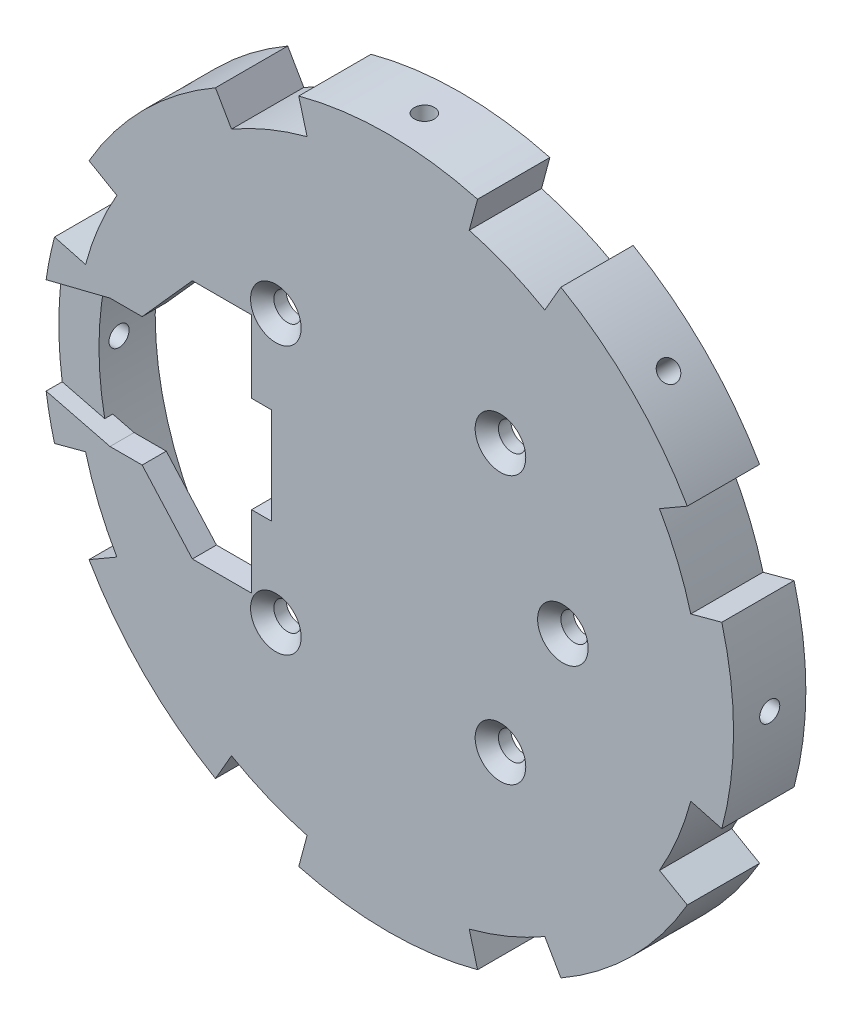
from build123d import *

# Parameters (mm, degrees)
SKETCH_1_R                   = 38
EXTRUDE_1_DEPTH              = 6
EXTRUDE_START                = 3
EXTRUDE_2_DEPTH              = 3
HOLE_WIZARD_M3_1_D           = 3.4
HOLE_WIZARD_M3_1_CSINK_D     = 6.3
HOLE_WIZARD_M3_1_CSINK_ANGLE = 90
M3X0_5_1_D                   = 2.5
M3X0_5_1_ON_FACE_2_D         = 2.5
M3X0_5_1_ON_FACE_3_D         = 2.5
M3X0_5_1_ON_FACE_4_D         = 2.5
M3X0_5_1_ON_FACE_5_D         = 2.5
M3X0_5_1_ON_FACE_6_D         = 2.5
M3X0_5_1_ON_FACE_7_D         = 2.5
M3X0_5_1_ON_FACE_8_D         = 2.5
CUT_EXTRUDE_START            = 3
CUT_EXTRUDE_1_DEPTH          = 3
EXTRUDE_START_2              = 1
EXTRUDE_3_DEPTH              = 1


with BuildPart() as part:
    # 草图1 → 凸台-拉伸1 (new body)
    with BuildSketch(Plane.XY):
        with BuildLine():
            Line((21.5, 37.239092363), (19.5, 33.774990748))
            ThreePointArc((19.5, 33.774990748), (14.924653862, 36.031301768), (10.093942759, 37.671107225))
            Line((10.093942759, 37.671107225), (11.129218939, 41.53481053))
            ThreePointArc((11.129218939, 41.53481053), (5.612626265, 42.632129039), (0, 43))
            ThreePointArc((0, 43), (-5.612626265, 42.632129039), (-11.129218939, 41.53481053))
            Line((-11.129218939, 41.53481053), (-10.093942759, 37.671107225))
            ThreePointArc((-10.093942759, 37.671107225), (-14.924653862, 36.031301768), (-19.5, 33.774990748))
            Line((-19.5, 33.774990748), (-21.5, 37.239092363))
            ThreePointArc((-21.5, 37.239092363), (-26.176741447, 34.114193633), (-30.405591591, 30.405591591))
            ThreePointArc((-30.405591591, 30.405591591), (-34.114193633, 26.176741447), (-37.239092363, 21.5))
            Line((-37.239092363, 21.5), (-33.774990748, 19.5))
            ThreePointArc((-33.774990748, 19.5), (-36.031301768, 14.924653862), (-37.671107225, 10.093942759))
            Line((-37.671107225, 10.093942759), (-41.53481053, 11.129218939))
            ThreePointArc((-41.53481053, 11.129218939), (-42.632129039, 5.612626265), (-43, 0))
            ThreePointArc((-43, 0), (-42.632129039, -5.612626265), (-41.53481053, -11.129218939))
            Line((-41.53481053, -11.129218939), (-37.671107225, -10.093942759))
            ThreePointArc((-37.671107225, -10.093942759), (-36.031301768, -14.924653862), (-33.774990748, -19.5))
            Line((-33.774990748, -19.5), (-37.239092363, -21.5))
            ThreePointArc((-37.239092363, -21.5), (-34.114193633, -26.176741447), (-30.405591591, -30.405591591))
            ThreePointArc((-30.405591591, -30.405591591), (-26.176741447, -34.114193633), (-21.5, -37.239092363))
            Line((-21.5, -37.239092363), (-19.5, -33.774990748))
            ThreePointArc((-19.5, -33.774990748), (-14.924653862, -36.031301768), (-10.093942759, -37.671107225))
            Line((-10.093942759, -37.671107225), (-11.129218939, -41.53481053))
            ThreePointArc((-11.129218939, -41.53481053), (-5.612626265, -42.632129039), (0, -43))
            ThreePointArc((0, -43), (5.612626265, -42.632129039), (11.129218939, -41.53481053))
            Line((11.129218939, -41.53481053), (10.093942759, -37.671107225))
            ThreePointArc((10.093942759, -37.671107225), (14.924653862, -36.031301768), (19.5, -33.774990748))
            Line((19.5, -33.774990748), (21.5, -37.239092363))
            ThreePointArc((21.5, -37.239092363), (26.176741447, -34.114193633), (30.405591591, -30.405591591))
            ThreePointArc((30.405591591, -30.405591591), (34.114193633, -26.176741447), (37.239092363, -21.5))
            Line((37.239092363, -21.5), (33.774990748, -19.5))
            ThreePointArc((33.774990748, -19.5), (36.031301768, -14.924653862), (37.671107225, -10.093942759))
            Line((37.671107225, -10.093942759), (41.53481053, -11.129218939))
            ThreePointArc((41.53481053, -11.129218939), (42.632129039, -5.612626265), (43, 0))
            ThreePointArc((43, 0), (42.632129039, 5.612626265), (41.53481053, 11.129218939))
            Line((41.53481053, 11.129218939), (37.671107225, 10.093942759))
            ThreePointArc((37.671107225, 10.093942759), (36.031301768, 14.924653862), (33.774990748, 19.5))
            Line((33.774990748, 19.5), (37.239092363, 21.5))
            ThreePointArc((37.239092363, 21.5), (34.114193633, 26.176741447), (30.405591591, 30.405591591))
            ThreePointArc((30.405591591, 30.405591591), (26.176741447, 34.114193633), (21.5, 37.239092363))
        make_face()
        Circle(SKETCH_1_R, mode=Mode.SUBTRACT)
    extrude(amount=-EXTRUDE_1_DEPTH)

    # 草图2 → 凸台-拉伸2 (add)
    with BuildSketch(Plane.XY.offset(EXTRUDE_START)):
        with BuildLine():
            Line((-11.129218939, 41.53481053), (-10.093942759, 37.671107225))
            ThreePointArc((-10.093942759, 37.671107225), (-14.924653862, 36.031301768), (-19.5, 33.774990748))
            Line((-19.5, 33.774990748), (-21.5, 37.239092363))
            ThreePointArc((-21.5, 37.239092363), (-26.176741447, 34.114193633), (-30.405591591, 30.405591591))
            ThreePointArc((-30.405591591, 30.405591591), (-34.114193633, 26.176741447), (-37.239092363, 21.5))
            Line((-37.239092363, 21.5), (-33.774990748, 19.5))
            ThreePointArc((-33.774990748, 19.5), (-36.031301768, 14.924653862), (-37.671107225, 10.093942759))
            Line((-37.671107225, 10.093942759), (-41.53481053, 11.129218939))
            ThreePointArc((-41.53481053, 11.129218939), (-42.632129039, 5.612626265), (-43, 0))
            ThreePointArc((-43, 0), (-42.632129039, -5.612626265), (-41.53481053, -11.129218939))
            Line((-41.53481053, -11.129218939), (-37.671107225, -10.093942759))
            ThreePointArc((-37.671107225, -10.093942759), (-36.031301768, -14.924653862), (-33.774990748, -19.5))
            Line((-33.774990748, -19.5), (-37.239092363, -21.5))
            ThreePointArc((-37.239092363, -21.5), (-34.114193633, -26.176741447), (-30.405591591, -30.405591591))
            ThreePointArc((-30.405591591, -30.405591591), (-26.176741447, -34.114193633), (-21.5, -37.239092363))
            Line((-21.5, -37.239092363), (-19.5, -33.774990748))
            ThreePointArc((-19.5, -33.774990748), (-14.924653862, -36.031301768), (-10.093942759, -37.671107225))
            Line((-10.093942759, -37.671107225), (-11.129218939, -41.53481053))
            ThreePointArc((-11.129218939, -41.53481053), (-5.612626265, -42.632129039), (0, -43))
            ThreePointArc((0, -43), (5.612626265, -42.632129039), (11.129218939, -41.53481053))
            Line((11.129218939, -41.53481053), (10.093942759, -37.671107225))
            ThreePointArc((10.093942759, -37.671107225), (14.924653862, -36.031301768), (19.5, -33.774990748))
            Line((19.5, -33.774990748), (21.5, -37.239092363))
            ThreePointArc((21.5, -37.239092363), (26.176741447, -34.114193633), (30.405591591, -30.405591591))
            ThreePointArc((30.405591591, -30.405591591), (34.114193633, -26.176741447), (37.239092363, -21.5))
            Line((37.239092363, -21.5), (33.774990748, -19.5))
            ThreePointArc((33.774990748, -19.5), (36.031301768, -14.924653862), (37.671107225, -10.093942759))
            Line((37.671107225, -10.093942759), (41.53481053, -11.129218939))
            ThreePointArc((41.53481053, -11.129218939), (42.632129039, -5.612626265), (43, 0))
            ThreePointArc((43, 0), (42.632129039, 5.612626265), (41.53481053, 11.129218939))
            Line((41.53481053, 11.129218939), (37.671107225, 10.093942759))
            ThreePointArc((37.671107225, 10.093942759), (36.031301768, 14.924653862), (33.774990748, 19.5))
            Line((33.774990748, 19.5), (37.239092363, 21.5))
            ThreePointArc((37.239092363, 21.5), (34.114193633, 26.176741447), (30.405591591, 30.405591591))
            ThreePointArc((30.405591591, 30.405591591), (26.176741447, 34.114193633), (21.5, 37.239092363))
            Line((21.5, 37.239092363), (19.5, 33.774990748))
            ThreePointArc((19.5, 33.774990748), (14.924653862, 36.031301768), (10.093942759, 37.671107225))
            Line((10.093942759, 37.671107225), (11.129218939, 41.53481053))
            ThreePointArc((11.129218939, 41.53481053), (5.612626265, 42.632129039), (0, 43))
            ThreePointArc((0, 43), (-5.612626265, 42.632129039), (-11.129218939, 41.53481053))
        make_face()
    extrude(amount=-EXTRUDE_2_DEPTH)

    # M3 锥坑平头的锥孔1 (through all)
    with Locations(Plane(origin=(13.98063051, -16.66146664, 3), x_dir=(1, 0, 0), z_dir=(0, 0, 1))):
        with Locations((0, 0), (7.76936949, 16.66146664), (0, 33.32293328), (-27.96126102, 0), (-35.73063051, 16.66146664), (-27.96126102, 33.32293328)):
            CounterSinkHole(HOLE_WIZARD_M3_1_D / 2, HOLE_WIZARD_M3_1_CSINK_D / 2, counter_sink_angle=HOLE_WIZARD_M3_1_CSINK_ANGLE)

    # M3x0.5 螺纹孔1 (through all)
    with Locations(Plane(origin=(0, -43, -1.5), x_dir=(-1, 0, 0), z_dir=(0, -1, 0))):
        with Locations((0, 0)):
            Hole(M3X0_5_1_D / 2)

    # M3x0.5 螺纹孔1 on face 2 (through all)
    with Locations(Plane(origin=(30.405591591, -30.405591591, -1.5), x_dir=(-0.707106781187, -0.707106781187, 0), z_dir=(0.707106781187, -0.707106781187, 0))):
        with Locations((0, 0)):
            Hole(M3X0_5_1_ON_FACE_2_D / 2)

    # M3x0.5 螺纹孔1 on face 3 (through all)
    with Locations(Plane(origin=(30.405591592, 30.40559159, -1.5), x_dir=(0.707106781187, -0.707106781187, 0), z_dir=(0.707106781187, 0.707106781187, 0))):
        with Locations((0, 0)):
            Hole(M3X0_5_1_ON_FACE_3_D / 2)

    # M3x0.5 螺纹孔1 on face 4 (through all)
    with Locations(Plane(origin=(43, 0, -1.5), x_dir=(0, 0, 1), z_dir=(1, 0, 0))):
        with Locations((0, 0)):
            Hole(M3X0_5_1_ON_FACE_4_D / 2)

    # M3x0.5 螺纹孔1 on face 5 (through all)
    with Locations(Plane(origin=(-30.405591591, 30.405591591, -1.5), x_dir=(0.707106781187, 0.707106781187, 0), z_dir=(-0.707106781187, 0.707106781187, 0))):
        with Locations((0, 0)):
            Hole(M3X0_5_1_ON_FACE_5_D / 2)

    # M3x0.5 螺纹孔1 on face 6 (through all)
    with Locations(Plane(origin=(-30.40559159, -30.405591592, -1.5), x_dir=(-0.707106781187, 0.707106781187, 0), z_dir=(-0.707106781187, -0.707106781187, 0))):
        with Locations((0, 0)):
            Hole(M3X0_5_1_ON_FACE_6_D / 2)

    # M3x0.5 螺纹孔1 on face 7 (through all)
    with Locations(Plane(origin=(-43, 0, -1.5), x_dir=(0, 0, -1), z_dir=(-1, 0, 0))):
        with Locations((0, 0)):
            Hole(M3X0_5_1_ON_FACE_7_D / 2)

    # M3x0.5 螺纹孔1 on face 8 (through all)
    with Locations(Plane(origin=(0, 43, -1.5), x_dir=(0, 0, 1), z_dir=(0, 1, 0))):
        with Locations((0, 0)):
            Hole(M3X0_5_1_ON_FACE_8_D / 2)

    # 草图6 → 切除-拉伸1 (cut)
    with BuildSketch(Plane.XY.offset(CUT_EXTRUDE_START)):
        with BuildLine():
            Line((-14.5, -6), (-14.5, 6))
            Line((-14.5, 6), (-17, 6))
            Line((-17, 6), (-17, 15))
            Line((-17, 15), (-24.37462575, 15))
            Line((-24.37462575, 15), (-30.624630174, 8))
            Line((-30.624630174, 8), (-34.624630174, 8))
            Line((-34.624630174, 8), (-42.579337712, 6))
            ThreePointArc((-42.579337712, 6), (-43, 0), (-42.579337712, -6))
            Line((-42.579337712, -6), (-34.624630174, -8))
            Line((-34.624630174, -8), (-30.624630174, -8))
            Line((-30.624630174, -8), (-24.37462575, -15))
            Line((-24.37462575, -15), (-17, -15))
            Line((-17, -15), (-17, -6))
            Line((-17, -6), (-14.5, -6))
        make_face()
    extrude(amount=-CUT_EXTRUDE_1_DEPTH, mode=Mode.SUBTRACT)

    # 草图9 → 凸台-拉伸3 (add)
    with BuildSketch(Plane.XY.offset(EXTRUDE_START_2)):
        with BuildLine():
            Line((-42.579337712, 6), (-37.286177193, 7.330824671))
            ThreePointArc((-37.286177193, 7.330824671), (-38, 0), (-37.286177193, -7.330824671))
            Line((-37.286177193, -7.330824671), (-42.579337712, -6))
            ThreePointArc((-42.579337712, -6), (-43, 0), (-42.579337712, 6))
        make_face()
    extrude(amount=-EXTRUDE_3_DEPTH)


solid = part.part
